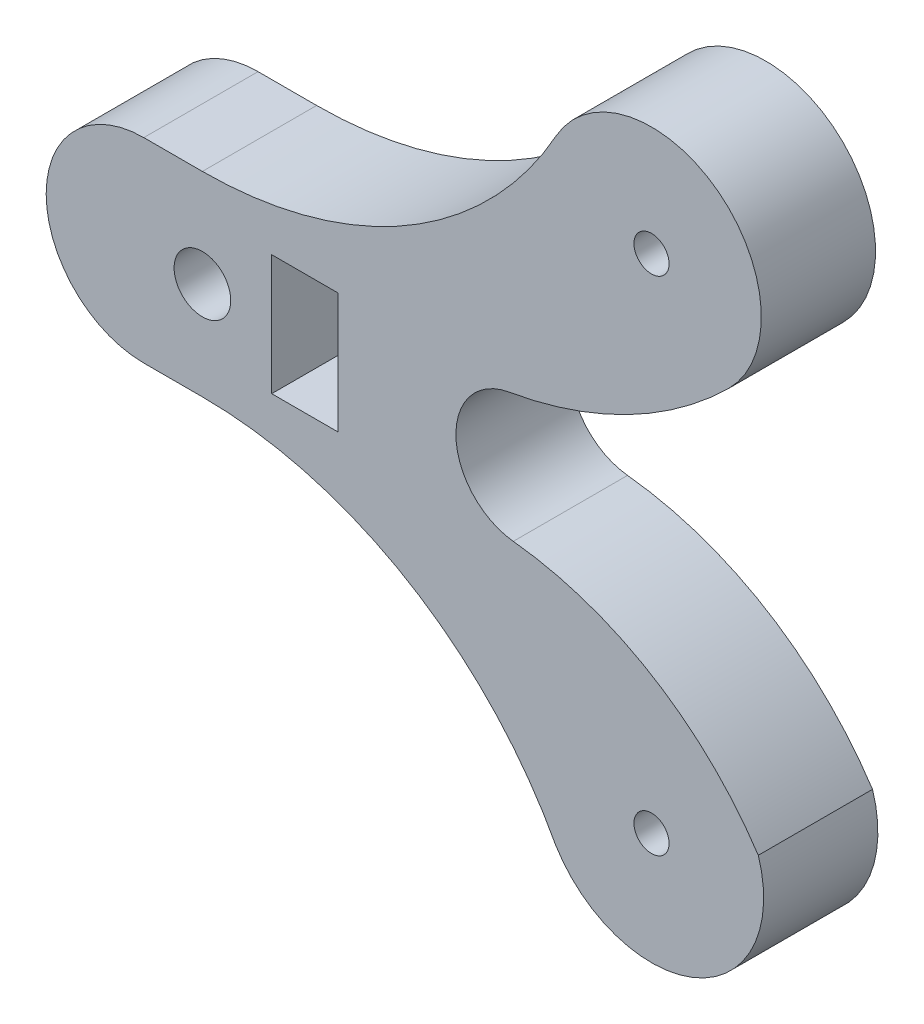
from build123d import *

# Parameters (mm, degrees)
SKETCH1_R           = 0.899963
SKETCH1_R_2         = 1.449813
SKETCH1_W           = 3.400011
SKETCH1_H           = 6.165182777
BOSS_EXTRUDE1_DEPTH = 5.85


with BuildPart() as part:
    # Sketch1 → Boss-Extrude1 (new body)
    with BuildSketch(Plane.XY):
        with BuildLine():
            Line((588.919699582, 440.365819013), (585.919699582, 440.365819013))
            ThreePointArc((585.919699582, 440.365819013), (580.919699582, 435.365819013), (585.919699582, 430.365819013))
            Line((585.919699582, 430.365819013), (588.919699582, 430.365819013))
            ThreePointArc((588.919699582, 430.365819013), (599.466979668, 427.448245018), (607.01549752, 419.525036483))
            ThreePointArc((607.01549752, 419.525036483), (614.308929148, 417.2909836), (617.387251852, 424.270171699))
            ThreePointArc((617.387251852, 424.270171699), (611.972289635, 429.501942053), (604.841840428, 431.920605104))
            ThreePointArc((604.841840428, 431.920605104), (601.90355313, 435.083688214), (604.628276781, 438.43249517))
            ThreePointArc((604.628276781, 438.43249517), (610.689278594, 440.465148492), (615.86711897, 444.214467303))
            ThreePointArc((615.86711897, 444.214467303), (615.349371021, 452.673761062), (607.039150964, 451.010043406))
            ThreePointArc((607.039150964, 451.010043406), (599.427006936, 443.223741749), (588.919699582, 440.365819013))
        make_face()
        with Locations((611.919699582, 448.218358123)):
            Circle(SKETCH1_R, mode=Mode.SUBTRACT)
        with Locations((611.919699582, 422.513279903)):
            Circle(SKETCH1_R, mode=Mode.SUBTRACT)
        with Locations((588.919699582, 435.365819013)):
            Circle(SKETCH1_R_2, mode=Mode.SUBTRACT)
        with Locations((594.169518082, 435.365819014)):
            Rectangle(SKETCH1_W, SKETCH1_H, mode=Mode.SUBTRACT)
    extrude(amount=BOSS_EXTRUDE1_DEPTH)


solid = part.part
